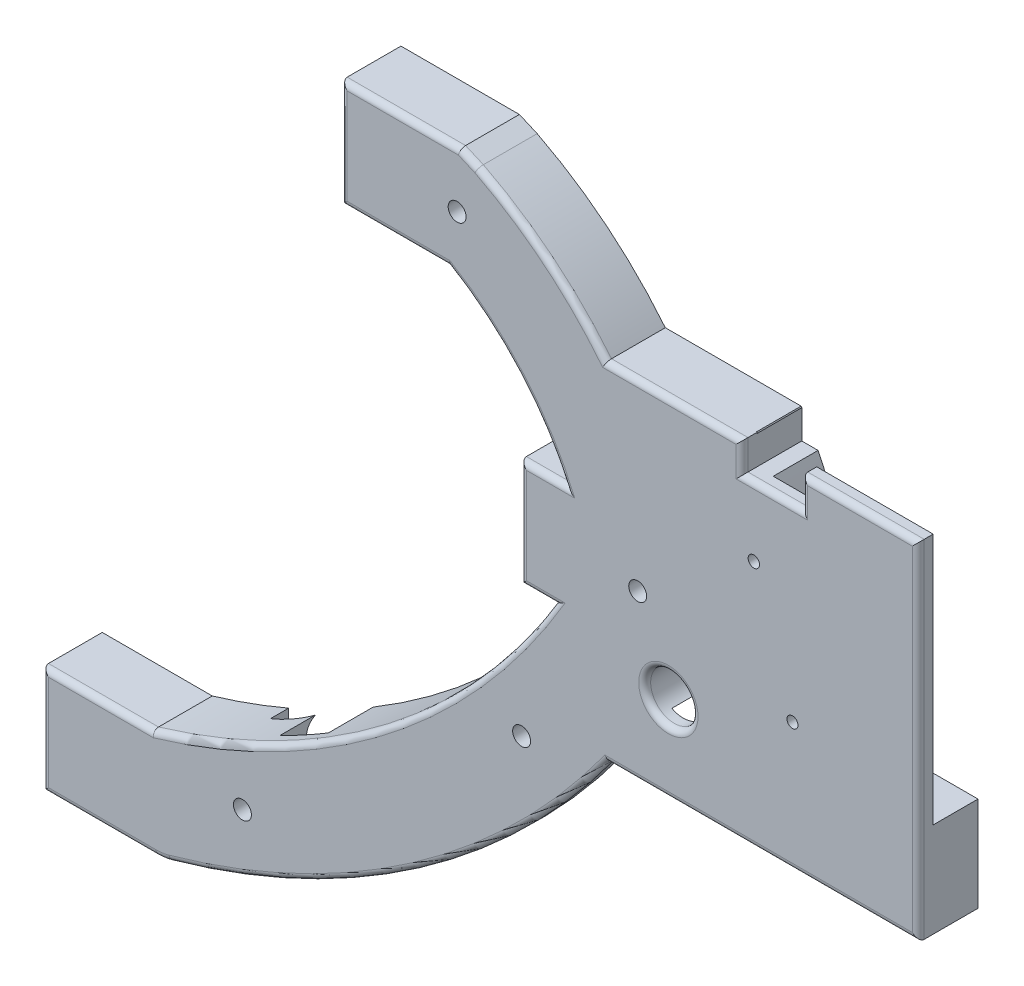
from build123d import *

# Parameters (mm, degrees)
SKETCH2_R           = 1.5
SKETCH2_R_2         = 0.950557093
SKETCH2_R_3         = 0.922721856
SKETCH2_R_4         = 3.961914324
BOSS_EXTRUDE1_DEPTH = 10
CUT_EXTRUDE2_DEPTH  = 7.5
SKETCH6_R           = 2.75
CUT_EXTRUDE3_DEPTH  = 6
SKETCH7_R           = 2.75
CUT_EXTRUDE4_DEPTH  = 16
FILLET4_R           = 1
FILLET6_R           = 1
BOSS_EXTRUDE2_START = 7
SKETCH10_R          = 3
SKETCH10_R_2        = 1.5
BOSS_EXTRUDE2_DEPTH = 7


with BuildPart() as part:
    # Sketch2 → Boss-Extrude1 (new body)
    with BuildSketch(Plane.XY):
        with BuildLine():
            Line((81.888577217, 91.458543207), (81.888577217, 86.458543207))
            Line((81.888577217, 86.458543207), (91.888577217, 86.458543207))
            Line((91.888577217, 86.458543207), (91.888577217, 91.458543207))
            Line((91.888577217, 91.458543207), (111.388577217, 91.458543207))
            Line((111.388577217, 91.458543207), (111.388577217, 33.45853824))
            Line((111.388577217, 33.45853824), (59.445423422, 33.45853824))
            ThreePointArc((59.445423422, 33.45853824), (27.133768023, 1.800076456), (-13.774490461, -17.508358618))
            ThreePointArc((-13.774490461, -17.508358618), (-14.978886944, -17.758945138), (-16.206169328, -17.843458112))
            Line((-16.206169328, -17.843458112), (-35.208422905, -17.843458747))
            Line((-35.208422905, -17.843458747), (-35.208422905, 0.156541253))
            Line((-35.208422905, 0.156541253), (-16.787077269, 0.156541253))
            ThreePointArc((-16.787077269, 0.156541253), (21.702242819, 19.892592348), (50.511565524, 52.156541253))
            Line((50.511565524, 52.156541253), (44.791577095, 52.156541253))
            Line((44.791577095, 52.156541253), (44.791577095, 70.156541253))
            Line((44.791577095, 70.156541253), (52.362539672, 70.156541253))
            ThreePointArc((52.362539672, 70.156541253), (44.221014667, 82.660480714), (32.711984921, 92.156541253))
            Line((32.711984921, 92.156541253), (14.791577095, 92.156541253))
            Line((14.791577095, 92.156541253), (14.791577095, 110.156541253))
            Line((14.791577095, 110.156541253), (34.618470591, 110.156541253))
            Line((34.618470591, 110.156541253), (37.597634379, 108.869828582))
            ThreePointArc((37.597634379, 108.869828582), (49.23853404, 101.293383128), (59.046132847, 91.458543207))
            Line((59.046132847, 91.458543207), (81.888577217, 91.458543207))
        make_face()
        with Locations((44.991577095, 30.225541253)):
            Circle(SKETCH2_R, mode=Mode.SUBTRACT)
        with Locations((64.422577095, 60.959541253)):
            Circle(SKETCH2_R, mode=Mode.SUBTRACT)
        with Locations((34.196577095, 100.837541253)):
            Circle(SKETCH2_R, mode=Mode.SUBTRACT)
        with Locations((83.863770594, 74.97281016)):
            Circle(SKETCH2_R_2, mode=Mode.SUBTRACT)
        with Locations((90.328907037, 54.916891625)):
            Circle(SKETCH2_R_3, mode=Mode.SUBTRACT)
        with Locations((-1.744422905, -3.810458747)):
            Circle(SKETCH2_R, mode=Mode.SUBTRACT)
        with Locations((69.558687686, 47.814657152)):
            Circle(SKETCH2_R_4, mode=Mode.SUBTRACT)
    extrude(amount=BOSS_EXTRUDE1_DEPTH)

    # Sketch5 → Cut-Extrude2 (cut)
    with BuildSketch(Plane(origin=(0, 0, 0), x_dir=(-1, 0, 0), z_dir=(0, 0, -1))):
        with BuildLine():
            Line((-48, 119.986383918), (-48, 122))
            Line((-48, 122), (-65.413446748, 122))
            Line((-65.413446748, 122), (-67.953495074, 120.902943041))
            ThreePointArc((-67.953495074, 120.902943041), (-79.578874442, 113.262929484), (-89.289650689, 103.302001953))
            Line((-89.289650689, 103.302001953), (-111.097000122, 103.302001953))
            Line((-111.097000122, 103.302001953), (-111.097000122, 98.302001953))
            Line((-111.097000122, 98.302001953), (-125.097000122, 98.302001953))
            Line((-125.097000122, 98.302001953), (-125.097000122, 103.302001953))
            Line((-125.097000122, 103.302001953), (-140.597000122, 103.302001953))
            Line((-140.597000122, 103.302001953), (-140.597000122, 49.301998138))
            Line((-140.597000122, 49.301998138), (-89.630276154, 49.301998138))
            ThreePointArc((-89.630276154, 49.301998138), (-57.616449712, 17.576361696), (-16.894067016, -1.739141214))
            ThreePointArc((-16.894067016, -1.739141214), (-15.957062749, -1.934133341), (-15.00225351, -1.999999365))
            Line((-15.00225351, -1.999999365), (2, -1.999999933))
            Line((2, -1.999999933), (2, 0.62055476))
            Line((2, 0.62055476), (-2.01199615, 0.620554799))
            Line((-2.01199615, 0.620554799), (-2.011996038, 10.004389316))
            Line((-2.011996038, 10.004389316), (2, 10.004389289))
            Line((2, 10.004389289), (2, 12))
            Line((2, 12), (-14.711901849, 12))
            ThreePointArc((-14.711901849, 12), (-55.403597764, 33.14849502), (-85.210401661, 68))
            Line((-85.210401661, 68), (-78, 68))
            Line((-78, 68), (-78, 70.61954768))
            Line((-78, 70.61954768), (-81.955004573, 70.619547719))
            Line((-81.955004573, 70.619547719), (-81.955004461, 80.003382236))
            Line((-81.955004461, 80.003382236), (-78, 80.003382209))
            Line((-78, 80.003382209), (-78, 82))
            Line((-78, 82), (-86.572081903, 82))
            ThreePointArc((-86.572081903, 82), (-77.744077966, 96.891878928), (-64.465849252, 108))
            Line((-64.465849252, 108), (-48, 108))
            Line((-48, 108), (-48, 110.356984483))
            Line((-48, 110.356984483), (-53, 110.356984483))
            Line((-53, 110.356984483), (-53, 119.822858969))
            Line((-53, 119.822858969), (-51.922991524, 119.822858969))
            Line((-51.922991524, 119.822858969), (-51.922991522, 119.986383945))
            Line((-51.922991522, 119.986383945), (-48, 119.986383918))
        make_face()
    extrude(amount=-CUT_EXTRUDE2_DEPTH, mode=Mode.SUBTRACT)

    # Sketch6 → Cut-Extrude3 (cut)
    with BuildSketch(Plane.ZY.offset(-76)):
        with Locations((0.305866026, 75.106920017)):
            Circle(SKETCH6_R)
    extrude(amount=-CUT_EXTRUDE3_DEPTH, mode=Mode.SUBTRACT)

    # Sketch7 → Cut-Extrude4 (cut)
    with BuildSketch(Plane.ZY.offset(4)):
        with Locations((0.305866026, 5.107927097)):
            Circle(SKETCH7_R)
    extrude(amount=-CUT_EXTRUDE4_DEPTH, mode=Mode.SUBTRACT)

    # Fillet4
    fillet4_edges = [part.edges().sort_by_distance(p)[0] for p in [
        (-25.707296116, -17.843458429, 10),
        (86.888577217, 86.458543207, 10),
        (81.888577217, 88.958543207, 10),
        (91.888577217, 88.958543207, 10),
        (-25.997750087, 0.156541253, 10),
        (21.702242819, 19.892592348, 10),
        (47.651571309, 52.156541253, 10),
        (44.791577095, 61.156541253, 10),
        (48.577058384, 70.156541253, 10),
        (44.221014667, 82.660480714, 10),
        (23.751781008, 92.156541253, 10),
        (14.791577095, 101.156541253, 10),
        (24.705023843, 110.156541253, 10),
        (36.108052485, 109.513184918, 10),
        (49.23853404, 101.293383128, 10),
        (70.467355032, 91.458543207, 10),
        (101.638577217, 91.458543207, 10),
        (111.388577217, 62.458540723, 10),
        (85.41700032, 33.45853824, 10),
        (27.133768023, 1.800076456, 10),
        (-14.978886944, -17.758945138, 10),
        (-35.208422905, -8.843458747, 10),
    ]]
    fillet(fillet4_edges, radius=FILLET4_R)

    # Fillet6
    fillet6_edges = [part.edges().sort_by_distance(p)[0] for p in [
        (65.596773362, 47.814657152, 10),
    ]]
    fillet(fillet6_edges, radius=FILLET6_R)

    # Sketch10 → Boss-Extrude2 (add)
    # profile 1 of 4: a face of its own
    with BuildSketch(Plane(origin=(0, 0, 7.5), x_dir=(-1, 0, 0), z_dir=(0, 0, -1)).offset(BOSS_EXTRUDE2_START)):
        with Locations((-64.422577095, 60.959541253)):
            Circle(SKETCH10_R)
        with Locations((-64.422577095, 60.959541253)):
            Circle(SKETCH10_R_2, mode=Mode.SUBTRACT)
    # profile 2 of 4: a face of its own
    with BuildSketch(Plane(origin=(0, 0, 7.5), x_dir=(-1, 0, 0), z_dir=(0, 0, -1)).offset(BOSS_EXTRUDE2_START)):
        with Locations((-44.991577095, 30.225541253)):
            Circle(SKETCH10_R)
        with Locations((-44.991577095, 30.225541253)):
            Circle(SKETCH10_R_2, mode=Mode.SUBTRACT)
    # profile 3 of 4: a face of its own
    with BuildSketch(Plane(origin=(0, 0, 7.5), x_dir=(-1, 0, 0), z_dir=(0, 0, -1)).offset(BOSS_EXTRUDE2_START)):
        with Locations((1.744422905, -3.810458747)):
            Circle(SKETCH10_R)
        with Locations((1.744422905, -3.810458747)):
            Circle(SKETCH10_R_2, mode=Mode.SUBTRACT)
    # profile 4 of 4: a face of its own
    with BuildSketch(Plane(origin=(0, 0, 7.5), x_dir=(-1, 0, 0), z_dir=(0, 0, -1)).offset(BOSS_EXTRUDE2_START)):
        with Locations((-34.196577095, 100.837541253)):
            Circle(SKETCH10_R)
        with Locations((-34.196577095, 100.837541253)):
            Circle(SKETCH10_R_2, mode=Mode.SUBTRACT)
    extrude(amount=-BOSS_EXTRUDE2_DEPTH)


solid = part.part
